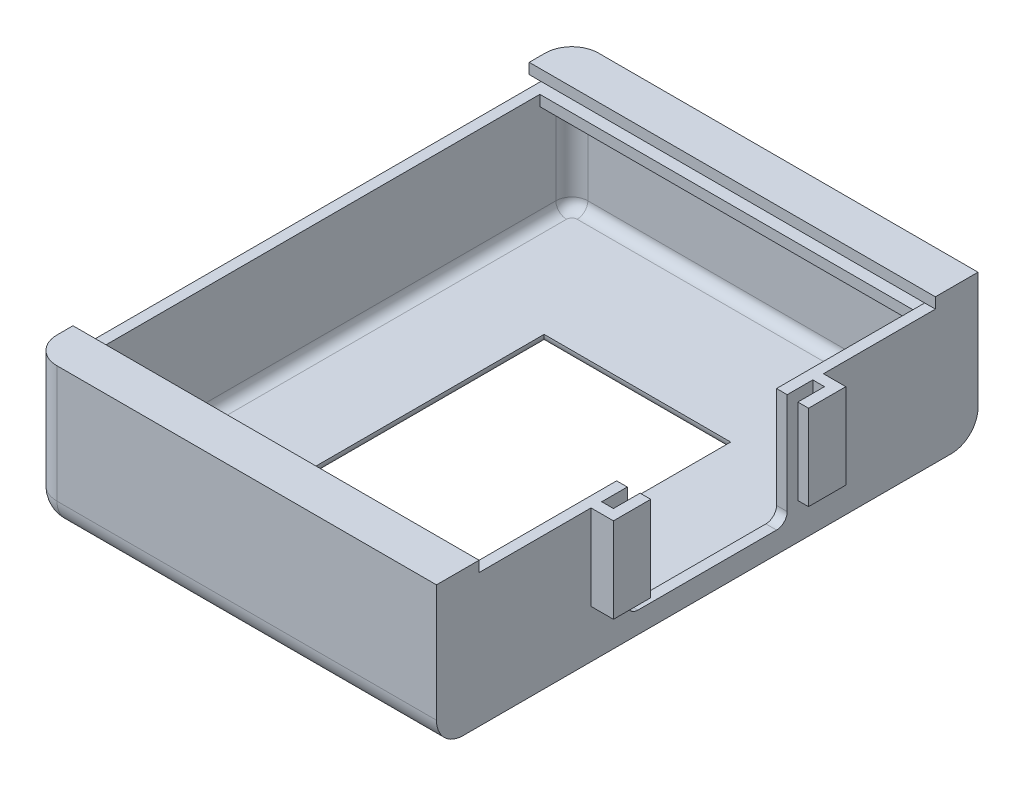
from build123d import *

# Parameters (mm, degrees)
SKETCH1_W             = 76.2
SKETCH1_H             = 101.6
BOSS_EXTRUDE1_DEPTH   = 25
SHELL1_T              = -2
SKETCH2_W             = 35
SKETCH2_H             = 50
CUT_EXTRUDE1_DEPTH    = 25
CUT_EXTRUDE2_REACH    = 96.932
FILLET1_R             = 5
FILLET2_R             = 3
FILLET3_R             = 2
FILLET4_R             = 5
BOSS_EXTRUDE4_DEPTH   = 2.2
BOSS_EXTRUDE4_2_DEPTH = 2.2
SKETCH4_W             = 91.6
SKETCH4_H             = 4.4
CUT_EXTRUDE3_DEPTH    = 2
BOSS_EXTRUDE2_START   = 2
BOSS_EXTRUDE2_DEPTH   = 2
LPATTERN1_COUNT       = 2
LPATTERN1_PITCH       = 4.2
BOSS_EXTRUDE3_START   = -9
BOSS_EXTRUDE3_DEPTH   = 16
FILLET5_R             = 2


with BuildPart() as part:
    # Sketch1 → Boss-Extrude1 (new body)
    with BuildSketch(Plane(origin=(0, 0, 0), x_dir=(1, 0, 0), z_dir=(0, 1, 0))):
        Rectangle(SKETCH1_W, SKETCH1_H)
    extrude(amount=BOSS_EXTRUDE1_DEPTH)

    # Shell1
    shell1_openings = [part.faces().sort_by_distance(p)[0] for p in [
        (0, 25, 0),
    ]]
    offset(amount=SHELL1_T, openings=shell1_openings, kind=Kind.INTERSECTION)

    # Sketch2 → Cut-Extrude1 (cut)
    with BuildSketch(Plane(origin=(0, 2, 0), x_dir=(1, 0, 0), z_dir=(0, 1, 0))):
        Rectangle(SKETCH2_W, SKETCH2_H)
    extrude(amount=-CUT_EXTRUDE1_DEPTH, mode=Mode.SUBTRACT)

    # Sketch3 → Cut-Extrude2 (cut, up to next)
    with BuildSketch(Plane(origin=(38.1, 0, 0), x_dir=(0, 0, -1), z_dir=(1, 0, 0)), mode=Mode.PRIVATE) as cut_extrude2_sk1:
        with BuildLine():
            Line((-15, 46), (15, 46))
            Line((15, 46), (15, 6))
            ThreePointArc((15, 6), (14.414213562, 4.585786438), (13, 4))
            Line((13, 4), (-13, 4))
            ThreePointArc((-13, 4), (-14.414213562, 4.585786438), (-15, 6))
            Line((-15, 6), (-15, 46))
        make_face()
    cut_extrude2_tool1 = extrude(cut_extrude2_sk1.sketch, amount=-CUT_EXTRUDE2_REACH, mode=Mode.PRIVATE) & part.part
    add(cut_extrude2_tool1.solids().sort_by_distance((38.1, 25.028043, 0))[0], mode=Mode.SUBTRACT)

    # Fillet1
    fillet1_edges = [part.edges().sort_by_distance(p)[0] for p in [
        (-38.1, 12.5, -50.8),
        (-38.1, 12.5, 50.8),
    ]]
    fillet(fillet1_edges, radius=FILLET1_R)

    # Fillet2
    fillet2_edges = [part.edges().sort_by_distance(p)[0] for p in [
        (-36.1, 13.5, -48.8),
        (-36.1, 13.5, 48.8),
        (36.1, 13.5, 48.8),
        (36.1, 13.5, -48.8),
    ]]
    fillet(fillet2_edges, radius=FILLET2_R)

    # Fillet3
    fillet3_edges = [part.edges().sort_by_distance(p)[0] for p in [
        (36.1, 2, 0),
        (-36.1, 2, 0),
        (0, 2, 48.8),
        (0, 2, -48.8),
        (-35.221320344, 2, -47.921320344),
        (-35.221320344, 2, 47.921320344),
        (35.221320344, 2, 47.921320344),
        (35.221320344, 2, -47.921320344),
    ]]
    fillet(fillet3_edges, radius=FILLET3_R - 0.0001)  # a hair under: the kernel refuses the full size

    # Fillet4
    fillet4_edges = [part.edges().sort_by_distance(p)[0] for p in [
        (2.5, 0, -50.8),
        (2.5, 0, 50.8),
        (-38.1, 0, 0),
        (-36.635533906, 0, -49.335533906),
        (-36.635533906, 0, 49.335533906),
    ]]
    fillet(fillet4_edges, radius=FILLET4_R)

    # Sketch4 → Cut-Extrude3 (cut)
    with BuildSketch(Plane.ZY.offset(38.1)):
        with Locations((0, 25)):
            Rectangle(SKETCH4_W, SKETCH4_H)
    extrude(amount=-CUT_EXTRUDE3_DEPTH, mode=Mode.SUBTRACT)

    # Sketch5 → Boss-Extrude2 (add)
    with BuildSketch(Plane(origin=(0, 25, 0), x_dir=(1, 0, 0), z_dir=(0, 1, 0)).offset(BOSS_EXTRUDE2_START)):
        with BuildLine():
            Line((-33.1, -50.8), (38.1, -50.8))
            Line((38.1, -50.8), (38.1, -42.8))
            Line((38.1, -42.8), (-38.1, -42.8))
            Line((-38.1, -42.8), (-38.1, -45.8))
            ThreePointArc((-38.1, -45.8), (-36.635533906, -49.335533906), (-33.1, -50.8))
        make_face()
        with BuildLine():
            Line((38.1, 50.8), (-33.1, 50.8))
            ThreePointArc((-33.1, 50.8), (-36.635533906, 49.335533906), (-38.1, 45.8))
            Line((-38.1, 45.8), (-38.1, 42.8))
            Line((-38.1, 42.8), (38.1, 42.8))
            Line((38.1, 42.8), (38.1, 50.8))
        make_face()
    boss_extrude2 = extrude(amount=-BOSS_EXTRUDE2_DEPTH)

    # LPattern1: Boss-Extrude2 ×2
    with Locations(*[(0, -i * LPATTERN1_PITCH, 0) for i in range(1, LPATTERN1_COUNT)]):
        add(boss_extrude2)

    # Sketch6 → Boss-Extrude3 (add)
    with BuildSketch(Plane.XZ.offset(BOSS_EXTRUDE3_START)):
        Polygon((38.1, -19.8), (38.1, -21.8), (42.3, -21.8), (42.3, -14.8), (40.3, -14.8), (40.3, -19.8), align=None)
        Polygon((40.3, 19.8), (38.1, 19.8), (38.1, 21.8), (42.3, 21.8), (42.3, 14.8), (40.3, 14.8), align=None)
    extrude(amount=-BOSS_EXTRUDE3_DEPTH)

    # Fillet5
    fillet5_edges = [part.edges().sort_by_distance(p)[0] for p in [
        (17.5, 0, 0),
        (0, 0, 25),
        (-17.5, 0, 0),
        (0, 0, -25),
    ]]
    fillet(fillet5_edges, radius=FILLET5_R - 0.0001)  # a hair under: the kernel refuses the full size


with BuildPart() as body_2:
    # Sketch7 → Boss-Extrude4 (new body)
    with BuildSketch(Plane(origin=(0, 25, 0), x_dir=(1, 0, 0), z_dir=(0, 1, 0))):
        with BuildLine():
            Line((-36.1, -45.8), (36.1, -45.8))
            ThreePointArc((36.1, -45.8), (35.221320344, -47.921320344), (33.1, -48.8))
            Line((33.1, -48.8), (-33.1, -48.8))
            ThreePointArc((-33.1, -48.8), (-35.221320344, -47.921320344), (-36.1, -45.8))
        make_face()
    extrude(amount=-BOSS_EXTRUDE4_DEPTH)


with BuildPart() as body_3:
    # Sketch7 → Boss-Extrude4 2 (new body)
    with BuildSketch(Plane(origin=(0, 25, 0), x_dir=(1, 0, 0), z_dir=(0, 1, 0))):
        with BuildLine():
            Line((-33.1, 48.8), (33.1, 48.8))
            ThreePointArc((33.1, 48.8), (35.221320344, 47.921320344), (36.1, 45.8))
            Line((36.1, 45.8), (-36.1, 45.8))
            ThreePointArc((-36.1, 45.8), (-35.221320344, 47.921320344), (-33.1, 48.8))
        make_face()
    extrude(amount=-BOSS_EXTRUDE4_2_DEPTH)


solid = Compound([part.part, body_2.part, body_3.part])
